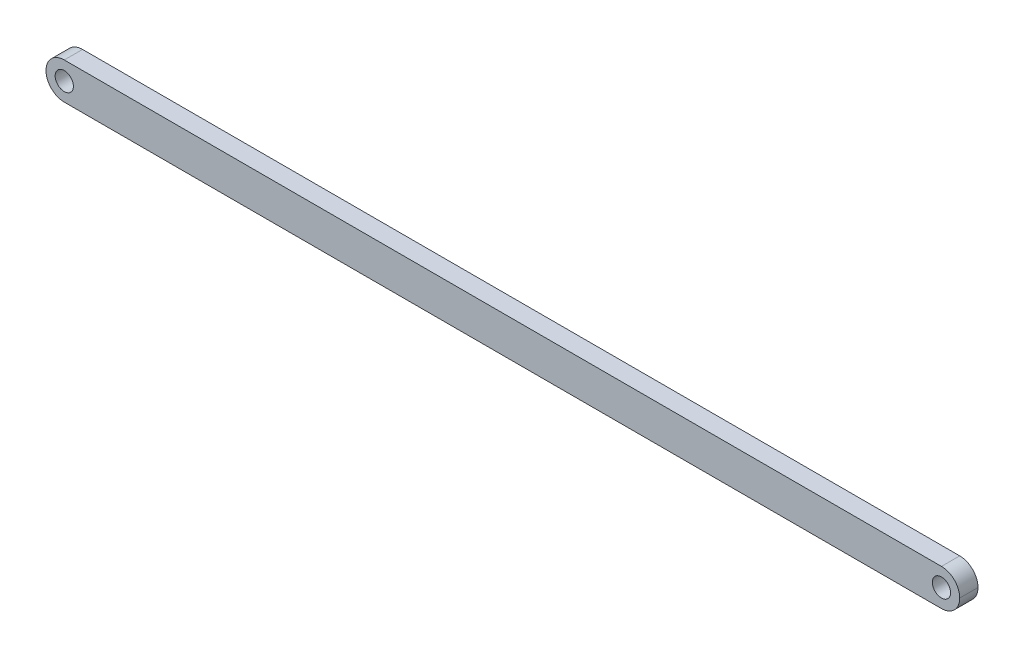
from build123d import *

# Parameters (mm, degrees)
SKETCH1_W           = 500
SKETCH1_H           = 20
SKETCH1_R           = 5
BOSS_EXTRUDE1_DEPTH = 10
FILLET1_R           = 10


with BuildPart() as part:
    # Sketch1 → Boss-Extrude1 (new body)
    with BuildSketch(Plane.XY):
        Rectangle(SKETCH1_W, SKETCH1_H)
        with Locations((-240, 0)):
            Circle(SKETCH1_R, mode=Mode.SUBTRACT)
        with Locations((240, 0)):
            Circle(SKETCH1_R, mode=Mode.SUBTRACT)
    extrude(amount=BOSS_EXTRUDE1_DEPTH)

    # Fillet1
    fillet1_edges = [part.edges().sort_by_distance(p)[0] for p in [
        (250, -10, 5),
        (250, 10, 5),
        (-250, -10, 5),
        (-250, 10, 5),
    ]]
    fillet(fillet1_edges, radius=FILLET1_R - 0.0001)  # a hair under: the kernel refuses the full size


solid = part.part
